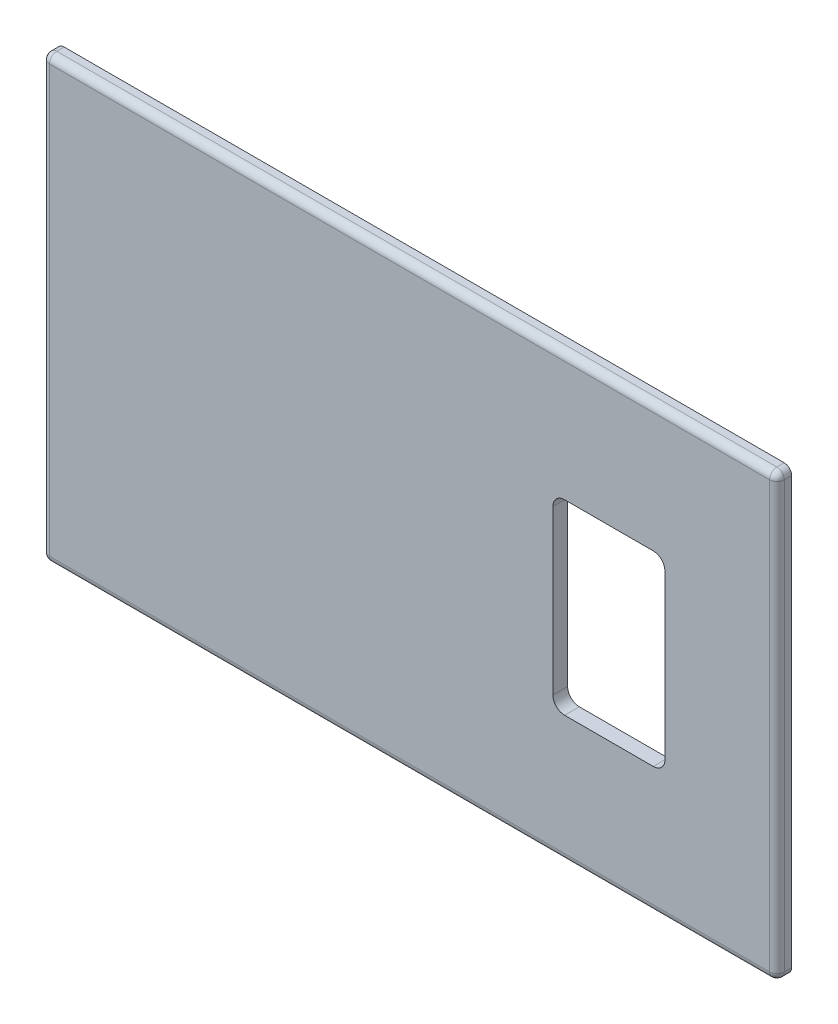
from build123d import *

# Parameters (mm, degrees)
SKETCH1_W           = 100
SKETCH1_H           = 60
BOSS_EXTRUDE1_DEPTH = 2
FILLET1_R           = 1
SKETCH2_W           = 15.24
SKETCH2_H           = 25.4
CUT_EXTRUDE1_DEPTH  = 59.343808583
FILLET2_R           = 1.5875


with BuildPart() as part:
    # Sketch1 → Boss-Extrude1 (new body)
    with BuildSketch(Plane.XY):
        Rectangle(SKETCH1_W, SKETCH1_H)
    extrude(amount=BOSS_EXTRUDE1_DEPTH)

    # Fillet1
    fillet1_edges = [part.edges().sort_by_distance(p)[0] for p in [
        (-50, 0, 2),
        (0, -30, 2),
        (50, 0, 2),
        (0, 30, 2),
        (50, 30, 1),
        (50, -30, 1),
        (-50, -30, 1),
        (-50, 30, 1),
    ]]
    fillet(fillet1_edges, radius=FILLET1_R)

    # Sketch2 → Cut-Extrude1 (cut, through all)
    with BuildSketch(Plane.XY.offset(2)):
        with Locations((27.14, 0)):
            Rectangle(SKETCH2_W, SKETCH2_H)
    extrude(amount=-CUT_EXTRUDE1_DEPTH, mode=Mode.SUBTRACT)

    # Fillet2
    fillet2_edges = [part.edges().sort_by_distance(p)[0] for p in [
        (19.52, 12.7, 1),
        (19.52, -12.7, 1),
        (34.76, -12.7, 1),
        (34.76, 12.7, 1),
    ]]
    fillet(fillet2_edges, radius=FILLET2_R)


solid = part.part
